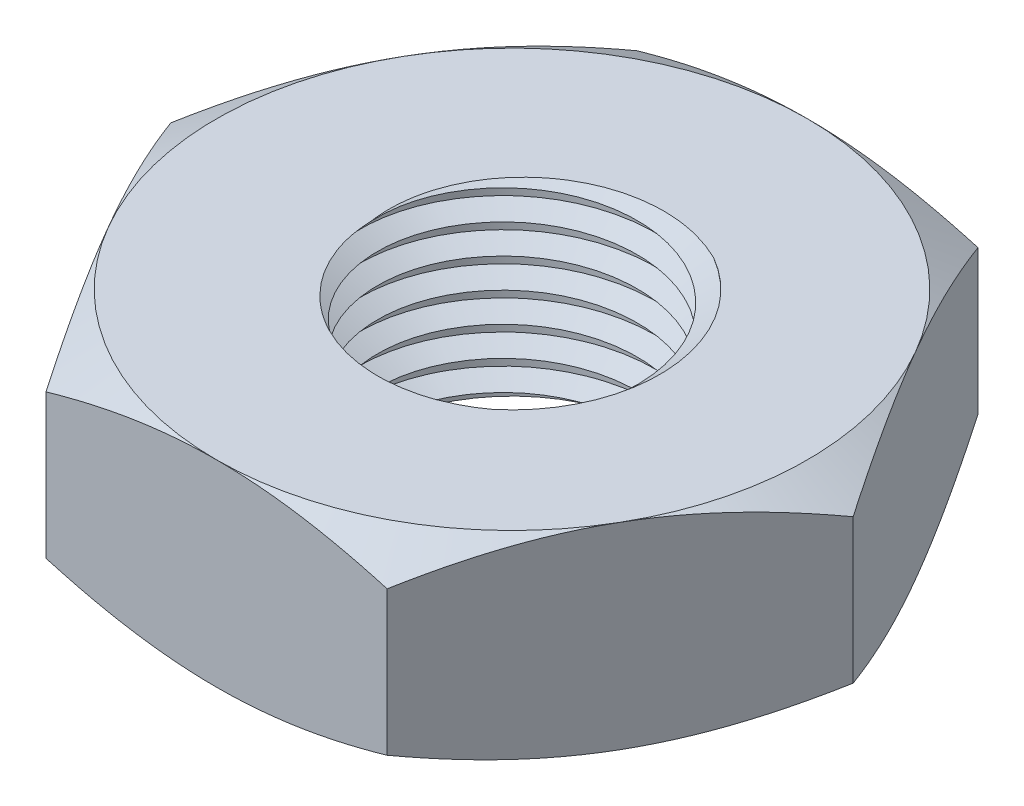
from build123d import *

# Parameters (mm, degrees)
BOSS_EXTRUDE1_DEPTH     = 10
SKETCH2_OUTSIDE_W       = 80.664
SKETCH2_OUTSIDE_H       = 76.022
SKETCH2_OUTSIDE_R       = 15
CUT_EXTRUDE2_DEPTH      = 10
CUT_EXTRUDE2_DRAFT      = -60
MIRROR1_COPY_1_SKETCH_W = 80.664
MIRROR1_COPY_1_SKETCH_H = 76.022
MIRROR1_COPY_1_SKETCH_R = 15
MIRROR1_COPY_1_DEPTH    = 10
MIRROR1_COPY_1_DRAFT    = -60
CUT_EXTRUDE3_DEPTH      = 24.452078799
CUT_EXTRUDE3_DEPTH_BACK = 24.452078799
SKETCH4_R               = 7.5
SWEEP1_PITCH            = 1.5
SKETCH9_W               = 26.31624861
SKETCH9_H               = 25.408923866
CUT_EXTRUDE4_DEPTH      = 27.873219


with BuildPart() as part:
    # Sketch1 → Boss-Extrude1 (new body)
    with BuildSketch(Plane(origin=(0, 0, 0), x_dir=(1, 0, 0), z_dir=(0, 1, 0))):
        Polygon((17.320508076, 0), (8.660254038, 15), (-8.660254038, 15), (-17.320508076, 0), (-8.660254038, -15), (8.660254038, -15), align=None)
    extrude(amount=BOSS_EXTRUDE1_DEPTH)


with BuildPart() as cut_extrude2_tool:
    # Sketch2 outside → Cut-Extrude2 (with draft: the straight prism first)
    with BuildSketch(Plane.XZ):
        Rectangle(SKETCH2_OUTSIDE_W, SKETCH2_OUTSIDE_H)
        Circle(SKETCH2_OUTSIDE_R, mode=Mode.SUBTRACT)
    extrude(amount=-CUT_EXTRUDE2_DEPTH)
    # Cut-Extrude2: the draft: its side faces are tilted about the plane it starts from
    cut_extrude2_sides = [cut_extrude2_tool.faces().sort_by_distance(p)[0] for p in [
        (0, 5, -38.011),
        (40.332, 5, 0),
        (0, 5, 38.011),
        (-40.332, 5, 0),
        (-15, 5, 0),
    ]]
    draft(cut_extrude2_sides, Plane.XZ, CUT_EXTRUDE2_DRAFT)


with BuildPart() as part_1:
    add(part.part)

    # Cut-Extrude2: cut by cut_extrude2_tool
    add(cut_extrude2_tool.part, mode=Mode.SUBTRACT)


with BuildPart() as mirror1_copy_1_tool:
    # Mirror1 copy 1 sketch → Mirror1 copy 1 (with draft: the straight prism first)
    with BuildSketch(Plane(origin=(0, 10, 0), x_dir=(1, 0, 0), z_dir=(0, 1, 0))):
        Rectangle(MIRROR1_COPY_1_SKETCH_W, MIRROR1_COPY_1_SKETCH_H)
        Circle(MIRROR1_COPY_1_SKETCH_R, mode=Mode.SUBTRACT)
    extrude(amount=-MIRROR1_COPY_1_DEPTH)
    # Mirror1 copy 1: the draft: its side faces are tilted about the plane it starts from
    mirror1_copy_1_sides = [mirror1_copy_1_tool.faces().sort_by_distance(p)[0] for p in [
        (0, 5, -38.011),
        (40.332, 5, 0),
        (0, 5, 38.011),
        (-40.332, 5, 0),
        (-15, 5, 0),
    ]]
    draft(mirror1_copy_1_sides, Plane(origin=(0, 10, 0), x_dir=(1, 0, 0), z_dir=(0, 1, 0)), MIRROR1_COPY_1_DRAFT)


with BuildPart() as part_2:
    add(part_1.part)

    # Mirror1 copy 1: cut by mirror1_copy_1_tool
    add(mirror1_copy_1_tool.part, mode=Mode.SUBTRACT)

    # Sketch4 → Cut-Extrude3 (cut, two sides: drawn at the far end of the back side and taken through both)
    with BuildSketch(Plane(origin=(0, 5, 0), x_dir=(-1, 0, 0), z_dir=(0, -1, 0)).offset(-CUT_EXTRUDE3_DEPTH_BACK)):
        with Locations(Location((0, 0, 0), (0, 0, 90))):
            Circle(SKETCH4_R)
    extrude(amount=CUT_EXTRUDE3_DEPTH + CUT_EXTRUDE3_DEPTH_BACK, mode=Mode.SUBTRACT)

    # Sweep1: the profile of Sketch8 profile screwed along a right-hand helix of 10 turns, 8 arcs to a turn; built about Z, then put on its axis
    sweep1_z = Axis((0, 0, 0), (0, 0, 1))
    sweep1_corners = [(7.5003, 0, -0.000173205), (7.5003, 0, 1.041719752), (6.597994231, 0, 0.520773274)]
    with BuildLine(mode=Mode.PRIVATE) as sweep1_profile:
        Line(sweep1_corners[0], sweep1_corners[1])
        Line(sweep1_corners[1], sweep1_corners[2])
        Line(sweep1_corners[2], sweep1_corners[0])
    sweep1_cap = Face(sweep1_profile.wire())
    sweep1_turn_angles = [0, 22.5, 45, 67.5, 90, 112.5, 135, 157.5, 180, 202.5, 225, 247.5, 270, 292.5, 315, 337.5, 360]
    sweep1_turn_weights = [1, 0.9238795325112867, 1, 0.9238795325112867, 1, 0.9238795325112867, 1, 0.9238795325112867, 1, 0.9238795325112867, 1, 0.9238795325112867, 1, 0.9238795325112867, 1, 0.9238795325112867, 1]
    sweep1_turn_rails = [Edge.make_bspline([Vector(p[0], p[1], 0).rotate(sweep1_z, sweep1_turn_angles[k]) / sweep1_turn_weights[k] + Vector(0, 0, p[2] + SWEEP1_PITCH * sweep1_turn_angles[k] / 360) for k in range(17)], [0, 0, 0, 1, 1, 2, 2, 3, 3, 4, 4, 5, 5, 6, 6, 7, 7, 8, 8, 8], 2, sweep1_turn_weights) for p in sweep1_corners]
    sweep1_turn_sides = [Face.make_surface_from_curves(sweep1_turn_rails[p[0]], sweep1_turn_rails[p[1]]) for p in [(0, 1), (1, 2), (2, 0)]]
    sweep1 = Plane(origin=(0, 12, 0), x_dir=(-1, 0, 0), z_dir=(0, -1, 0)) * Solid(Shell([*[p.moved(Location((0, 0, SWEEP1_PITCH * i))) for i in range(10) for p in sweep1_turn_sides], sweep1_cap, sweep1_cap.rotate(sweep1_z, 3600).moved(Location((0, 0, SWEEP1_PITCH * 3600 / 360)))]))
    add(sweep1)

    # Sketch9 → Cut-Extrude4 (cut, through all)
    with BuildSketch(Plane(origin=(0, 10, 0), x_dir=(1, 0, 0), z_dir=(0, 1, 0))):
        Rectangle(SKETCH9_W, SKETCH9_H)
    cut_extrude4 = extrude(amount=CUT_EXTRUDE4_DEPTH, mode=Mode.SUBTRACT)

    # Mirror2: Cut-Extrude4 across plane
    add(cut_extrude4.mirror(Plane(origin=(0, 5, 0), x_dir=(0, 0, 1), z_dir=(0, -1, 0))), mode=Mode.SUBTRACT)


solid = part_2.part
